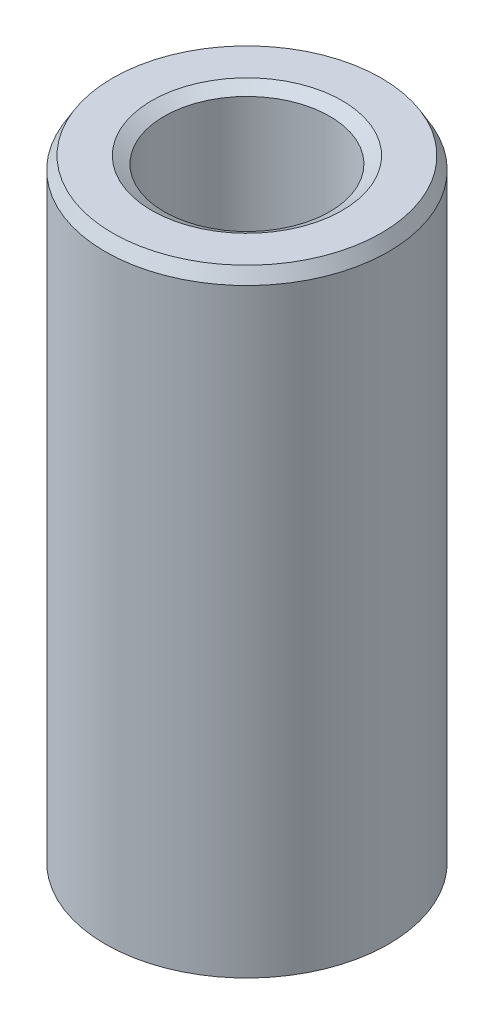
from build123d import *
from OCP.BRepFilletAPI import BRepFilletAPI_MakeChamfer

# Parameters (mm, degrees)
SKETCH1_R           = 10
BOSS_EXTRUDE1_DEPTH = 43.74215766
SKETCH2_R           = 5.844195611
CUT_EXTRUDE1_DEPTH  = 46.971473293
CHAMFER1_SIZE       = 0.879795685
CHAMFER1_SIZE2      = 0.515276525


with BuildPart() as part:
    # Sketch1 → Boss-Extrude1 (new body)
    with BuildSketch(Plane(origin=(0, 0, 0), x_dir=(1, 0, 0), z_dir=(0, 1, 0))):
        Circle(SKETCH1_R)
    extrude(amount=BOSS_EXTRUDE1_DEPTH)

    # Sketch2 → Cut-Extrude1 (cut, through all)
    with BuildSketch(Plane(origin=(0, 0, 0), x_dir=(1, 0, 0), z_dir=(0, 1, 0))):
        Circle(SKETCH2_R)
    extrude(amount=CUT_EXTRUDE1_DEPTH, mode=Mode.SUBTRACT)

    # Chamfer1: one chamfer whose edges measure the first distance from different faces: ONE call of the kernel's chamfer builder (chamfer() names one face for all edges)
    chamfer1_edges_1 = [part.edges().sort_by_distance(p)[0] for p in [
        (-5.844195611, 43.74215766, 0),
    ]]
    chamfer1_side_1 = [part.faces().sort_by_distance(p)[0] for p in [
        (-9.717157288, 43.74215766, 0),
    ]]
    chamfer1_edges_2 = [part.edges().sort_by_distance(p)[0] for p in [
        (-5.844195611, 0, 0),
    ]]
    chamfer1_side_2 = [part.faces().sort_by_distance(p)[0] for p in [
        (-5.844195611, 21.87107883, 0),
    ]]
    chamfer1_edges_3 = [part.edges().sort_by_distance(p)[0] for p in [
        (-10, 0, 0),
    ]]
    chamfer1_side_3 = [part.faces().sort_by_distance(p)[0] for p in [
        (-9.717157288, 0, 0),
    ]]
    chamfer1_edges_4 = [part.edges().sort_by_distance(p)[0] for p in [
        (-10, 43.74215766, 0),
    ]]
    chamfer1_side_4 = [part.faces().sort_by_distance(p)[0] for p in [
        (-10, 21.87107883, 0),
    ]]
    chamfer1 = BRepFilletAPI_MakeChamfer(part.part.solid().wrapped)
    for e in chamfer1_edges_1:
        chamfer1.Add(CHAMFER1_SIZE, CHAMFER1_SIZE2, e.wrapped, chamfer1_side_1[0].wrapped)  # the first distance lies on this face
    for e in chamfer1_edges_2:
        chamfer1.Add(CHAMFER1_SIZE, CHAMFER1_SIZE2, e.wrapped, chamfer1_side_2[0].wrapped)  # the first distance lies on this face
    for e in chamfer1_edges_3:
        chamfer1.Add(CHAMFER1_SIZE, CHAMFER1_SIZE2, e.wrapped, chamfer1_side_3[0].wrapped)  # the first distance lies on this face
    for e in chamfer1_edges_4:
        chamfer1.Add(CHAMFER1_SIZE, CHAMFER1_SIZE2, e.wrapped, chamfer1_side_4[0].wrapped)  # the first distance lies on this face
    add(Compound.cast(chamfer1.Shape()), mode=Mode.REPLACE)


solid = part.part
